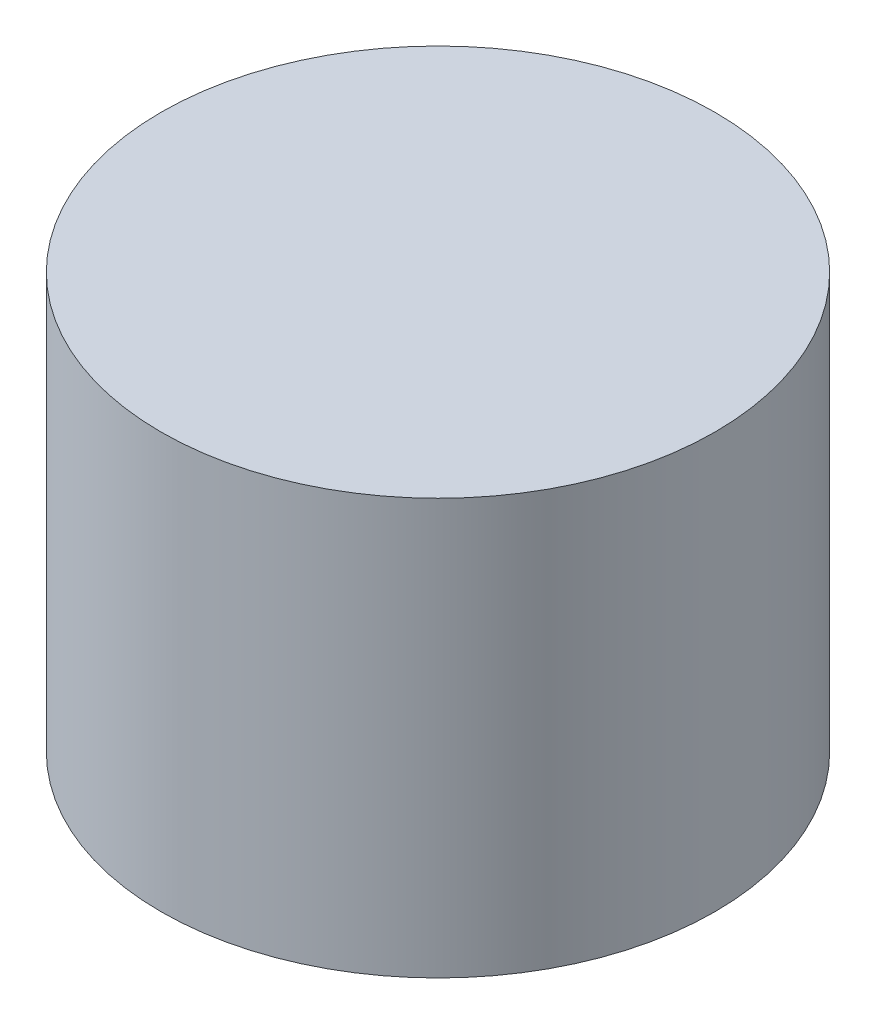
from build123d import *

# Parameters (mm, degrees)
SKETCH1_R                   = 25.4
BOSS_EXTRUDE1_DEPTH         = 38.1
F_1_4_20_TAPPED_HOLE4_D     = 5.1054
F_1_4_20_TAPPED_HOLE4_DEPTH = 15.875
F_1_4_20_TAPPED_HOLE4_TIP   = 1.533816902


with BuildPart() as part:
    # Sketch1 → Boss-Extrude1 (new body)
    with BuildSketch(Plane(origin=(0, 0, 0), x_dir=(1, 0, 0), z_dir=(0, 1, 0))):
        Circle(SKETCH1_R)
    extrude(amount=BOSS_EXTRUDE1_DEPTH)

    # 1/4-20 Tapped Hole4
    with Locations(Plane(origin=(0, 0, 0), x_dir=(-1, 0, 0), z_dir=(0, -1, 0))):
        with Locations((12.7, 0), (-12.7, 0)):
            Hole(F_1_4_20_TAPPED_HOLE4_D / 2, depth=F_1_4_20_TAPPED_HOLE4_DEPTH)
            with Locations((0, 0, -(F_1_4_20_TAPPED_HOLE4_DEPTH + F_1_4_20_TAPPED_HOLE4_TIP / 2))):  # 118° drill point
                Cone(0, F_1_4_20_TAPPED_HOLE4_D / 2, F_1_4_20_TAPPED_HOLE4_TIP, mode=Mode.SUBTRACT)


solid = part.part
